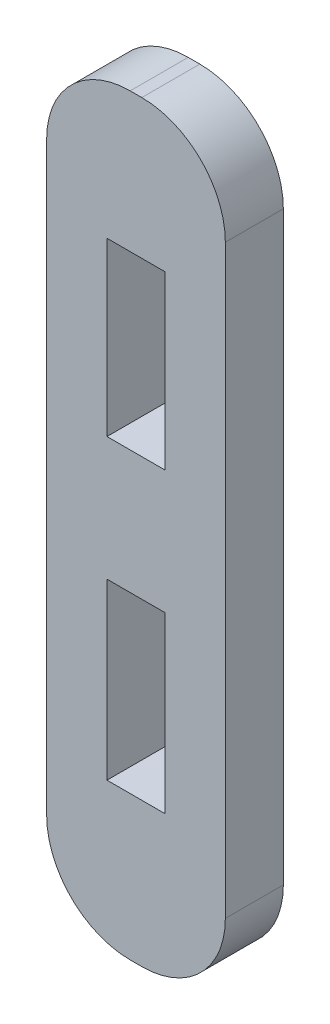
from build123d import *

# Parameters (mm, degrees)
SKETCH1_W           = 4.8895
SKETCH1_H           = 20.594711744
BOSS_EXTRUDE1_DEPTH = 1.5875
CUT_EXTRUDE1_DEPTH  = 22.226622866
FILLET1_R           = 2.286


with BuildPart() as part:
    # Sketch1 → Boss-Extrude1 (new body)
    with BuildSketch(Plane.XY):
        with Locations((2.44475, 10.297355872)):
            Rectangle(SKETCH1_W, SKETCH1_H)
    extrude(amount=BOSS_EXTRUDE1_DEPTH)

    # Sketch2 → Cut-Extrude1 (cut, through all)
    with BuildSketch(Plane(origin=(0, 0, 0), x_dir=(-1, 0, 0), z_dir=(0, 0, -1))):
        Polygon((-3.2385, 14.244711744), (-3.2385, 12.085711744), (-1.651, 12.085711744), (-1.651, 14.244711744), (-1.651, 15.400896877), (-1.651, 15.728171243), (-1.651, 16.784711744), (-3.2385, 16.784711744), (-3.2385, 15.728171243), (-3.2385, 15.400896877), align=None)
        Polygon((-1.651, 5.226982741), (-1.651, 6.41449647), (-1.651, 8.706104955), (-3.2385, 8.706104955), (-3.2385, 6.41449647), (-3.2385, 5.226982741), (-3.2385, 4.866556254), (-3.2385, 3.942624238), (-1.651, 3.942624238), (-1.651, 4.866556254), align=None)
    extrude(amount=-CUT_EXTRUDE1_DEPTH, mode=Mode.SUBTRACT)

    # Fillet1
    fillet1_edges = [part.edges().sort_by_distance(p)[0] for p in [
        (0, 0, 0.79375),
        (4.8895, 0, 0.79375),
        (4.8895, 20.594711744, 0.79375),
        (0, 20.594711744, 0.79375),
    ]]
    fillet(fillet1_edges, radius=FILLET1_R)


solid = part.part
